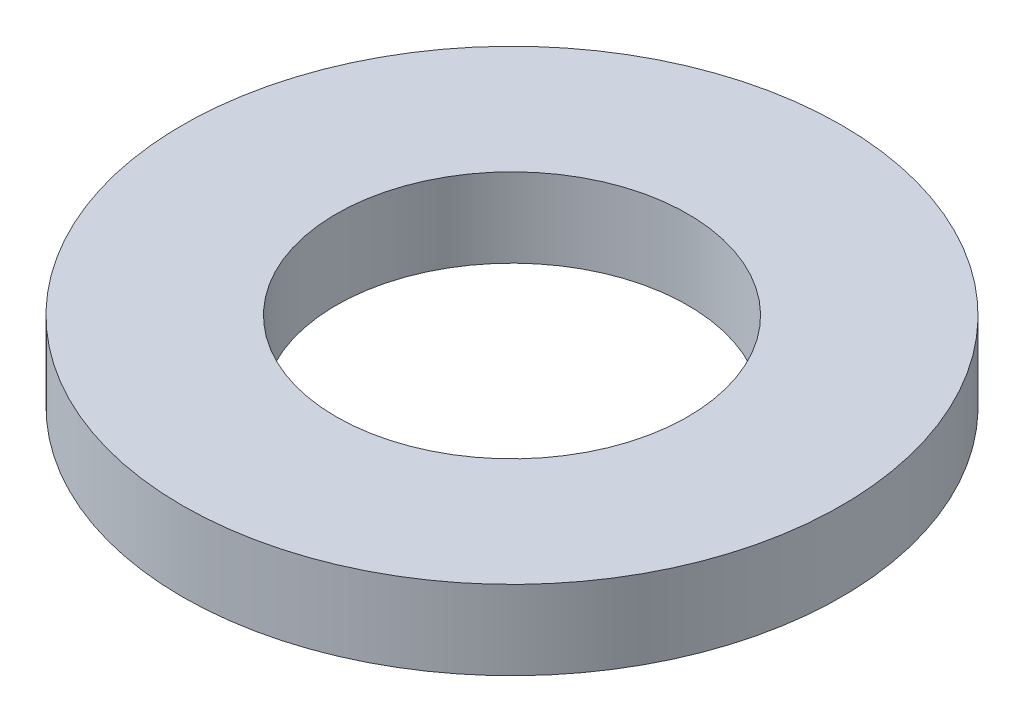
from build123d import *

# Parameters (mm, degrees)
SKETCH1_R           = 37.5
BOSS_EXTRUDE1_DEPTH = 9
SKETCH2_R           = 20
CUT_EXTRUDE1_DEPTH  = 54.791263231


with BuildPart() as part:
    # Sketch1 → Boss-Extrude1 (new body)
    with BuildSketch(Plane(origin=(0, 0, 0), x_dir=(1, 0, 0), z_dir=(0, 1, 0))):
        Circle(SKETCH1_R)
    extrude(amount=BOSS_EXTRUDE1_DEPTH)

    # Sketch2 → Cut-Extrude1 (cut, through all)
    with BuildSketch(Plane(origin=(0, 0, 0), x_dir=(1, 0, 0), z_dir=(0, 1, 0))):
        Circle(SKETCH2_R)
    extrude(amount=CUT_EXTRUDE1_DEPTH, mode=Mode.SUBTRACT)


solid = part.part
